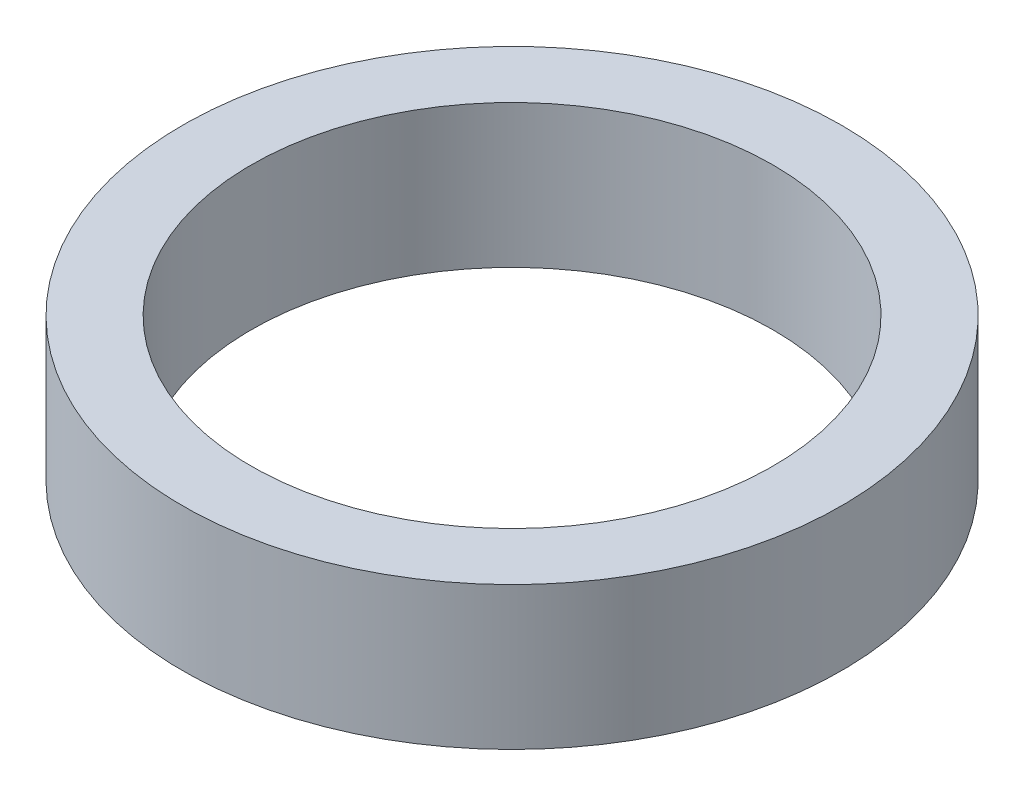
from build123d import *

# Parameters (mm, degrees)
SKETCH1_R           = 60
BOSS_EXTRUDE1_DEPTH = 26
SKETCH2_R           = 47.5
CUT_EXTRUDE1_DEPTH  = 89.746830929


with BuildPart() as part:
    # Sketch1 → Boss-Extrude1 (new body)
    with BuildSketch(Plane(origin=(0, 0, 0), x_dir=(1, 0, 0), z_dir=(0, 1, 0))):
        Circle(SKETCH1_R)
    extrude(amount=BOSS_EXTRUDE1_DEPTH)

    # Sketch2 → Cut-Extrude1 (cut, through all)
    with BuildSketch(Plane(origin=(0, 0, 0), x_dir=(1, 0, 0), z_dir=(0, 1, 0))):
        Circle(SKETCH2_R)
    extrude(amount=CUT_EXTRUDE1_DEPTH, mode=Mode.SUBTRACT)


solid = part.part
